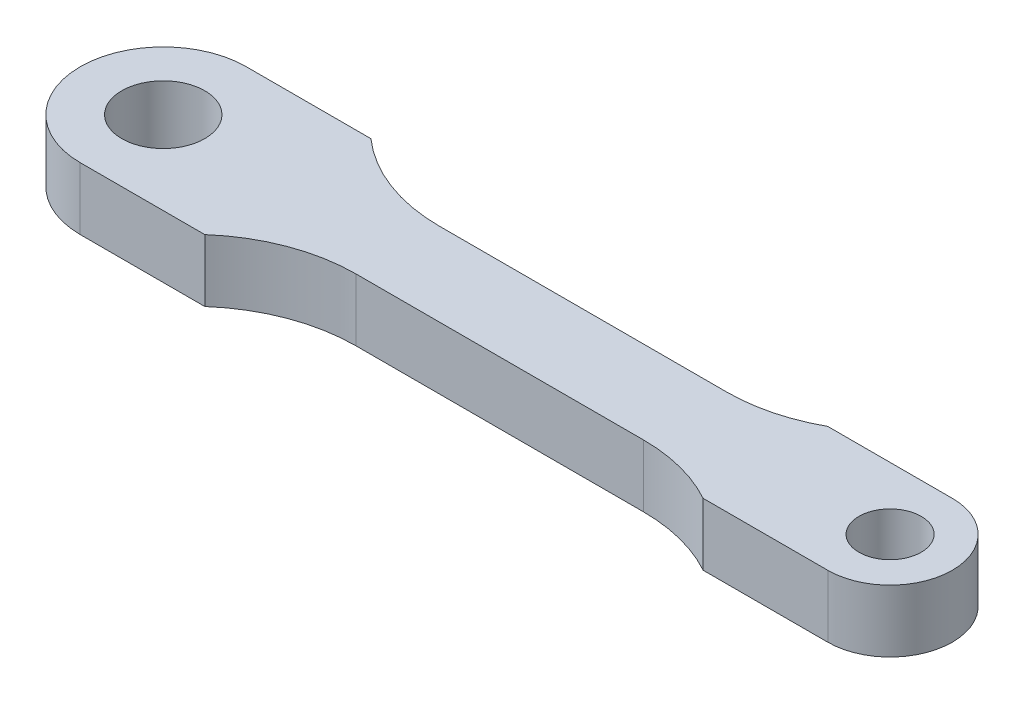
from build123d import *

# Parameters (mm, degrees)
SKETCH1_R               = 2
BOSS_EXTRUDE1_DEPTH     = 1.5
CUT_EXTRUDE1_DEPTH      = 22.920310217
CUT_EXTRUDE1_DEPTH_BACK = 22.920310217
SKETCH1_4_R             = 1.5


with BuildPart() as part:
    # Sketch1 → Boss-Extrude1 (new, symmetric)
    with BuildSketch(Plane(origin=(0, 0, 0), x_dir=(1, 0, 0), z_dir=(0, 1, 0))):
        with BuildLine():
            ThreePointArc((-17.5, 4), (-21.5, 0), (-17.5, -4))
            Line((-17.5, -4), (-11.5, -4))
            ThreePointArc((-11.5, -4), (-9.036924503, -2.516685226), (-6.208497378, -2))
            Line((-6.208497378, -2), (7.627016654, -2))
            ThreePointArc((7.627016654, -2), (9.627016654, -2.254033308), (11.5, -3))
            Line((11.5, -3), (17.5, -3))
            ThreePointArc((17.5, -3), (20.5, 0), (17.5, 3))
            Line((17.5, 3), (11.5, 3))
            ThreePointArc((11.5, 3), (9.627016654, 2.254033308), (7.627016654, 2))
            Line((7.627016654, 2), (-6.208497378, 2))
            ThreePointArc((-6.208497378, 2), (-9.036924503, 2.516685226), (-11.5, 4))
            Line((-11.5, 4), (-17.5, 4))
        make_face()
        with Locations((-17.5, 0)):
            Circle(SKETCH1_R, mode=Mode.SUBTRACT)
    extrude(amount=BOSS_EXTRUDE1_DEPTH, both=True)

    # Sketch1<4> → Cut-Extrude1 (cut, two sides: drawn at the far end of the back side and taken through both)
    with BuildSketch(Plane(origin=(0, 0, 0), x_dir=(1, 0, 0), z_dir=(0, 1, 0)).offset(-CUT_EXTRUDE1_DEPTH_BACK)):
        with Locations((17.5, 0)):
            Circle(SKETCH1_4_R)
    extrude(amount=CUT_EXTRUDE1_DEPTH + CUT_EXTRUDE1_DEPTH_BACK, mode=Mode.SUBTRACT)


solid = part.part
